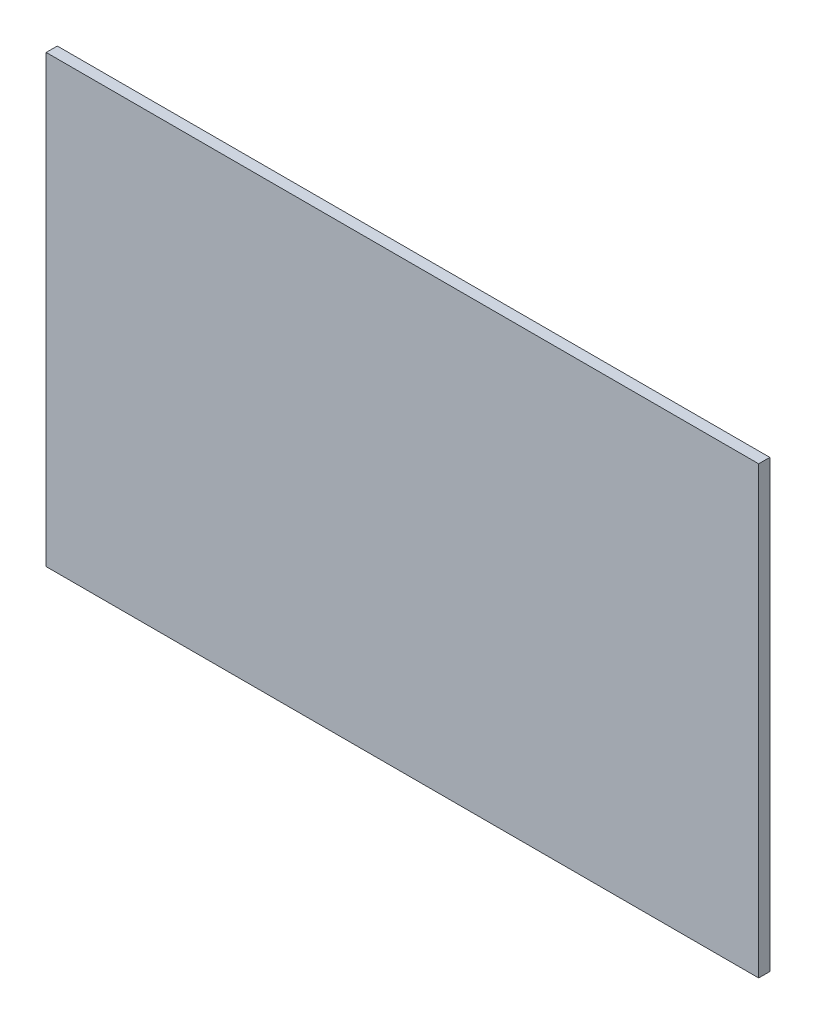
from build123d import *

# Parameters (mm, degrees)
SKETCH1_W          = 320
SKETCH1_H          = 200
BASE_FLANGE1_DEPTH = 5


# Sheet-metal steps are written as plain solids
with BuildPart() as part:
    # Sketch1 → Base-Flange1 (new body)
    with BuildSketch(Plane.XY):
        Rectangle(SKETCH1_W, SKETCH1_H)
    extrude(amount=-BASE_FLANGE1_DEPTH)


solid = part.part
